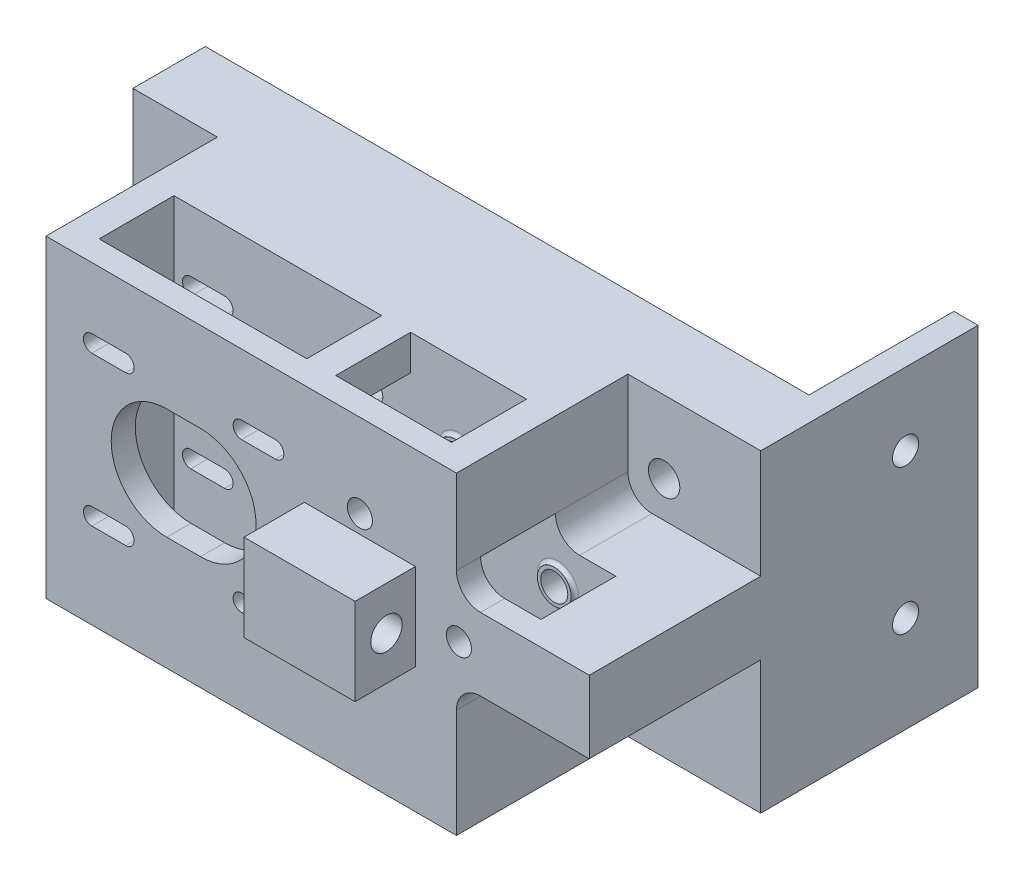
from build123d import *

# Parameters (mm, degrees)
SKETCH1_W           = 125
SKETCH1_H           = 60
SKETCH1_R           = 2.8
SKETCH1_R_2         = 3.25
SKETCH1_R_3         = 2.75
BOSS_EXTRUDE1_DEPTH = 30
CUT_EXTRUDE1_DEPTH  = 15
SKETCH3_R           = 3.25
CUT_EXTRUDE2_DEPTH  = 19
BOSS_EXTRUDE2_DEPTH = 5
BOSS_EXTRUDE3_REACH = 143.863
SKETCH5_W           = 6
SKETCH5_H           = 60
SKETCH5_H_2         = 17.5
SKETCH5_H_3         = 7.275
SKETCH5_W_2         = 3
SKETCH5_W_3         = 10
SKETCH5_H_4         = 15
CUT_EXTRUDE3_DEPTH  = 148.564392724
SKETCH7_W           = 23
SKETCH7_H           = 18
BOSS_EXTRUDE4_DEPTH = 12.5
SKETCH8_R           = 3.25
CUT_EXTRUDE4_DEPTH  = 129.082004981
SKETCH9_R           = 2.7
SKETCH9_W           = 24
SKETCH9_H           = 15.5
SKETCH9_W_2         = 46
BOSS_EXTRUDE5_DEPTH = 5
SKETCH10_R          = 2.7
BOSS_EXTRUDE6_DEPTH = 5
SKETCH11_R          = 2.6
CUT_EXTRUDE5_DEPTH  = 158.877325794
SKETCH12_R          = 3.5
SKETCH12_R_2        = 2.8
BOSS_EXTRUDE7_DEPTH = 0.75
FILLET1_R           = 0.75


with BuildPart() as part:
    # Sketch1 → Boss-Extrude1 (new body)
    with BuildSketch(Plane.XY):
        with Locations((-62.5, 30)):
            Rectangle(SKETCH1_W, SKETCH1_H)
        with Locations((-42.5, 42.725)):
            Circle(SKETCH1_R, mode=Mode.SUBTRACT)
        with Locations((-22, 30)):
            Circle(SKETCH1_R, mode=Mode.SUBTRACT)
        with Locations((-15, 45)):
            Circle(SKETCH1_R_2, mode=Mode.SUBTRACT)
        with Locations((-15, 15)):
            Circle(SKETCH1_R_2, mode=Mode.SUBTRACT)
        with Locations((-115, 15)):
            Circle(SKETCH1_R_3, mode=Mode.SUBTRACT)
        with Locations((-115, 45)):
            Circle(SKETCH1_R_3, mode=Mode.SUBTRACT)
    extrude(amount=BOSS_EXTRUDE1_DEPTH)

    # Sketch2 → Cut-Extrude1 (cut)
    with BuildSketch(Plane.XY.offset(30)):
        with BuildLine():
            Line((0, 0), (-22.5, 0))
            Line((-22.5, 0), (-22.5, 17.5))
            ThreePointArc((-22.5, 17.5), (-21.035533906, 21.035533906), (-17.5, 22.5))
            Line((-17.5, 22.5), (0, 22.5))
            Line((0, 22.5), (0, 0))
        make_face()
        with BuildLine():
            Line((0, 60), (-22.5, 60))
            Line((-22.5, 60), (-22.5, 42.5))
            ThreePointArc((-22.5, 42.5), (-21.035533906, 38.964466094), (-17.5, 37.5))
            Line((-17.5, 37.5), (0, 37.5))
            Line((0, 37.5), (0, 60))
        make_face()
        with BuildLine():
            Line((-107.5, 60), (-107.5, 42.5))
            ThreePointArc((-107.5, 42.5), (-108.964466094, 38.964466094), (-112.5, 37.5))
            Line((-112.5, 37.5), (-125, 37.5))
            Line((-125, 37.5), (-125, 60))
            Line((-125, 60), (-107.5, 60))
        make_face()
        with BuildLine():
            Line((-125, 0), (-107.5, 0))
            Line((-107.5, 0), (-107.5, 17.5))
            ThreePointArc((-107.5, 17.5), (-108.964466094, 21.035533906), (-112.5, 22.5))
            Line((-112.5, 22.5), (-125, 22.5))
            Line((-125, 22.5), (-125, 0))
        make_face()
    extrude(amount=-CUT_EXTRUDE1_DEPTH, mode=Mode.SUBTRACT)

    # Sketch3 → Cut-Extrude2 (cut)
    with BuildSketch(Plane(origin=(0, 0, 0), x_dir=(-1, 0, 0), z_dir=(0, 0, -1))):
        with Locations((22, 30)):
            Circle(SKETCH3_R)
        with Locations((42.5, 42.725)):
            Circle(SKETCH3_R)
    extrude(amount=-CUT_EXTRUDE2_DEPTH, mode=Mode.SUBTRACT)


with BuildPart() as body_2:
    # Sketch4 → Boss-Extrude2 (new body)
    with BuildSketch(Plane.XY.offset(45.5)):
        with BuildLine():
            Line((-107.5, 60), (-107.5, 0))
            Line((-107.5, 0), (-22.5, 0))
            Line((-22.5, 0), (-22.5, 17.5))
            ThreePointArc((-22.5, 17.5), (-21.035533906, 21.035533906), (-17.5, 22.5))
            Line((-17.5, 22.5), (0, 22.5))
            Line((0, 22.5), (0, 37.5))
            Line((0, 37.5), (-17.5, 37.5))
            ThreePointArc((-17.5, 37.5), (-21.035533906, 38.964466094), (-22.5, 42.5))
            Line((-22.5, 42.5), (-22.5, 60))
            Line((-22.5, 60), (-107.5, 60))
        make_face()
    extrude(amount=BOSS_EXTRUDE2_DEPTH)

    # Sketch5 → Boss-Extrude3 (add, up to next)
    with BuildSketch(Plane.XY.offset(30), mode=Mode.PRIVATE) as boss_extrude3_sk1:
        with Locations((-104.5, 30)):
            Rectangle(SKETCH5_W, SKETCH5_H)
    boss_extrude3_tool1 = extrude(boss_extrude3_sk1.sketch, amount=BOSS_EXTRUDE3_REACH, mode=Mode.PRIVATE) - body_2.part
    # Sketch5 → Boss-Extrude3 (add, up to next)
    with BuildSketch(Plane.XY.offset(30), mode=Mode.PRIVATE) as boss_extrude3_sk2:
        with Locations((-25.5, 8.75)):
            Rectangle(SKETCH5_W, SKETCH5_H_2)
    boss_extrude3_tool2 = extrude(boss_extrude3_sk2.sketch, amount=BOSS_EXTRUDE3_REACH, mode=Mode.PRIVATE) - body_2.part
    # Sketch5 → Boss-Extrude3 (add, up to next)
    with BuildSketch(Plane.XY.offset(30), mode=Mode.PRIVATE) as boss_extrude3_sk3:
        with Locations((-25.5, 51.25)):
            Rectangle(SKETCH5_W, SKETCH5_H_2)
    boss_extrude3_tool3 = extrude(boss_extrude3_sk3.sketch, amount=BOSS_EXTRUDE3_REACH, mode=Mode.PRIVATE) - body_2.part
    # Sketch5 → Boss-Extrude3 (add, up to next)
    with BuildSketch(Plane.XY.offset(30), mode=Mode.PRIVATE) as boss_extrude3_sk4:
        with Locations((-55.5, 56.3625)):
            Rectangle(SKETCH5_W, SKETCH5_H_3)
    boss_extrude3_tool4 = extrude(boss_extrude3_sk4.sketch, amount=BOSS_EXTRUDE3_REACH, mode=Mode.PRIVATE) - body_2.part
    # Sketch5 → Boss-Extrude3 (add, up to next)
    with BuildSketch(Plane.XY.offset(30), mode=Mode.PRIVATE) as boss_extrude3_sk5:
        with Locations((-54, 8.75)):
            Rectangle(SKETCH5_W_2, SKETCH5_H_2)
    boss_extrude3_tool5 = extrude(boss_extrude3_sk5.sketch, amount=BOSS_EXTRUDE3_REACH, mode=Mode.PRIVATE) - body_2.part
    # Sketch5 → Boss-Extrude3 (add, up to next)
    with BuildSketch(Plane.XY.offset(30), mode=Mode.PRIVATE) as boss_extrude3_sk6:
        with Locations((-5, 30)):
            Rectangle(SKETCH5_W_3, SKETCH5_H_4)
    boss_extrude3_tool6 = extrude(boss_extrude3_sk6.sketch, amount=BOSS_EXTRUDE3_REACH, mode=Mode.PRIVATE) - body_2.part

    add(part.part)  # Boss-Extrude3 merges part
    add(boss_extrude3_tool1.solids().sort_by_distance((-104.5, 30, 30))[0])
    add(boss_extrude3_tool2.solids().sort_by_distance((-25.5, 8.75, 30))[0])
    add(boss_extrude3_tool3.solids().sort_by_distance((-25.5, 51.25, 30))[0])
    add(boss_extrude3_tool4.solids().sort_by_distance((-55.5, 56.3625, 30))[0])
    add(boss_extrude3_tool5.solids().sort_by_distance((-54, 8.75, 30))[0])
    add(boss_extrude3_tool6.solids().sort_by_distance((-5, 30, 30))[0])

    # Sketch6 → Cut-Extrude3 (cut, through all)
    with BuildSketch(Plane.XY.offset(50.5)):
        with BuildLine():
            Line((-82.5, 41.5), (-75.5, 41.5))
            ThreePointArc((-75.5, 41.5), (-64, 30), (-75.5, 18.5))
            Line((-75.5, 18.5), (-82.5, 18.5))
            ThreePointArc((-82.5, 18.5), (-94, 30), (-82.5, 41.5))
        make_face()
        with BuildLine():
            Line((-91, 43.75), (-98, 43.75))
            ThreePointArc((-98, 43.75), (-99.75, 45.5), (-98, 47.25))
            Line((-98, 47.25), (-91, 47.25))
            ThreePointArc((-91, 47.25), (-89.25, 45.5), (-91, 43.75))
        make_face()
        with BuildLine():
            Line((-67, 47.25), (-60, 47.25))
            ThreePointArc((-60, 47.25), (-58.25, 45.5), (-60, 43.75))
            Line((-60, 43.75), (-67, 43.75))
            ThreePointArc((-67, 43.75), (-68.75, 45.5), (-67, 47.25))
        make_face()
        with BuildLine():
            Line((-91, 12.75), (-98, 12.75))
            ThreePointArc((-98, 12.75), (-99.75, 14.5), (-98, 16.25))
            Line((-98, 16.25), (-91, 16.25))
            ThreePointArc((-91, 16.25), (-89.25, 14.5), (-91, 12.75))
        make_face()
        with BuildLine():
            Line((-67, 16.25), (-60, 16.25))
            ThreePointArc((-60, 16.25), (-58.25, 14.5), (-60, 12.75))
            Line((-60, 12.75), (-67, 12.75))
            ThreePointArc((-67, 12.75), (-68.75, 14.5), (-67, 16.25))
        make_face()
    extrude(amount=-CUT_EXTRUDE3_DEPTH, mode=Mode.SUBTRACT)

    # Sketch7 → Boss-Extrude4 (add)
    with BuildSketch(Plane.XY.offset(50.5)):
        with Locations((-42.5, 30)):
            Rectangle(SKETCH7_W, SKETCH7_H)
    extrude(amount=BOSS_EXTRUDE4_DEPTH)

    # Sketch8 → Cut-Extrude4 (cut, through all)
    with BuildSketch(Plane(origin=(-31, 0, 0), x_dir=(0, 0, -1), z_dir=(1, 0, 0))):
        with Locations((-56.5, 30)):
            Circle(SKETCH8_R)
    extrude(amount=-CUT_EXTRUDE4_DEPTH, mode=Mode.SUBTRACT)

    # Sketch9 → Boss-Extrude5 (add)
    with BuildSketch(Plane.XZ):
        Polygon((-125, 15), (-107.5, 15), (-107.5, 50.5), (-22.5, 50.5), (-22.5, 15), (0, 15), (0, -30), (-125, -30), align=None)
        with Locations((-110, -15)):
            Circle(SKETCH9_R, mode=Mode.SUBTRACT)
        with Locations((-80, -15)):
            Circle(SKETCH9_R, mode=Mode.SUBTRACT)
        with Locations((-45, -15)):
            Circle(SKETCH9_R, mode=Mode.SUBTRACT)
        with Locations((-15, -15)):
            Circle(SKETCH9_R, mode=Mode.SUBTRACT)
        with Locations((-40.5, 37.75)):
            Rectangle(SKETCH9_W, SKETCH9_H, mode=Mode.SUBTRACT)
        with Locations((-78.5, 37.75)):
            Rectangle(SKETCH9_W_2, SKETCH9_H, mode=Mode.SUBTRACT)
    extrude(amount=BOSS_EXTRUDE5_DEPTH)

    # Sketch10 → Boss-Extrude6 (add)
    with BuildSketch(Plane(origin=(0, 0, 0), x_dir=(0, 0, -1), z_dir=(1, 0, 0))):
        Polygon((-50.5, 37.5), (-50.5, 22.5), (-15, 22.5), (-15, -5), (30, -5), (30, 60), (-15, 60), (-15, 37.5), align=None)
        with Locations((15, 45)):
            Circle(SKETCH10_R, mode=Mode.SUBTRACT)
        with Locations((15, 15)):
            Circle(SKETCH10_R, mode=Mode.SUBTRACT)
    extrude(amount=BOSS_EXTRUDE6_DEPTH)

    # Sketch11 → Cut-Extrude5 (cut, through all)
    with BuildSketch(Plane(origin=(0, 0, 45.5), x_dir=(-1, 0, 0), z_dir=(0, 0, -1))):
        with Locations((42.5, 42.725)):
            Circle(SKETCH11_R)
        with Locations((22, 30)):
            Circle(SKETCH11_R)
    extrude(amount=-CUT_EXTRUDE5_DEPTH, mode=Mode.SUBTRACT)

    # Sketch12 → Boss-Extrude7 (add)
    # profile 1 of 2: a face of its own
    with BuildSketch(Plane.XY.offset(30)):
        with Locations((-22, 30)):
            Circle(SKETCH12_R)
        with Locations(Location((-22, 30, 0), (0, 0, 180))):
            Circle(SKETCH12_R_2, mode=Mode.SUBTRACT)
    # profile 2 of 2: a face of its own
    with BuildSketch(Plane.XY.offset(30)):
        with Locations((-42.5, 42.725)):
            Circle(SKETCH12_R)
        with Locations(Location((-42.5, 42.725, 0), (0, 0, 180))):
            Circle(SKETCH12_R_2, mode=Mode.SUBTRACT)
    extrude(amount=BOSS_EXTRUDE7_DEPTH)

    # Fillet1
    fillet1_edges = [body_2.edges().sort_by_distance(p)[0] for p in [
        (-25.5, 30, 30),
        (-46, 42.725, 30),
    ]]
    fillet(fillet1_edges, radius=FILLET1_R - 0.0001)  # a hair under: the kernel refuses the full size


solid = body_2.part
